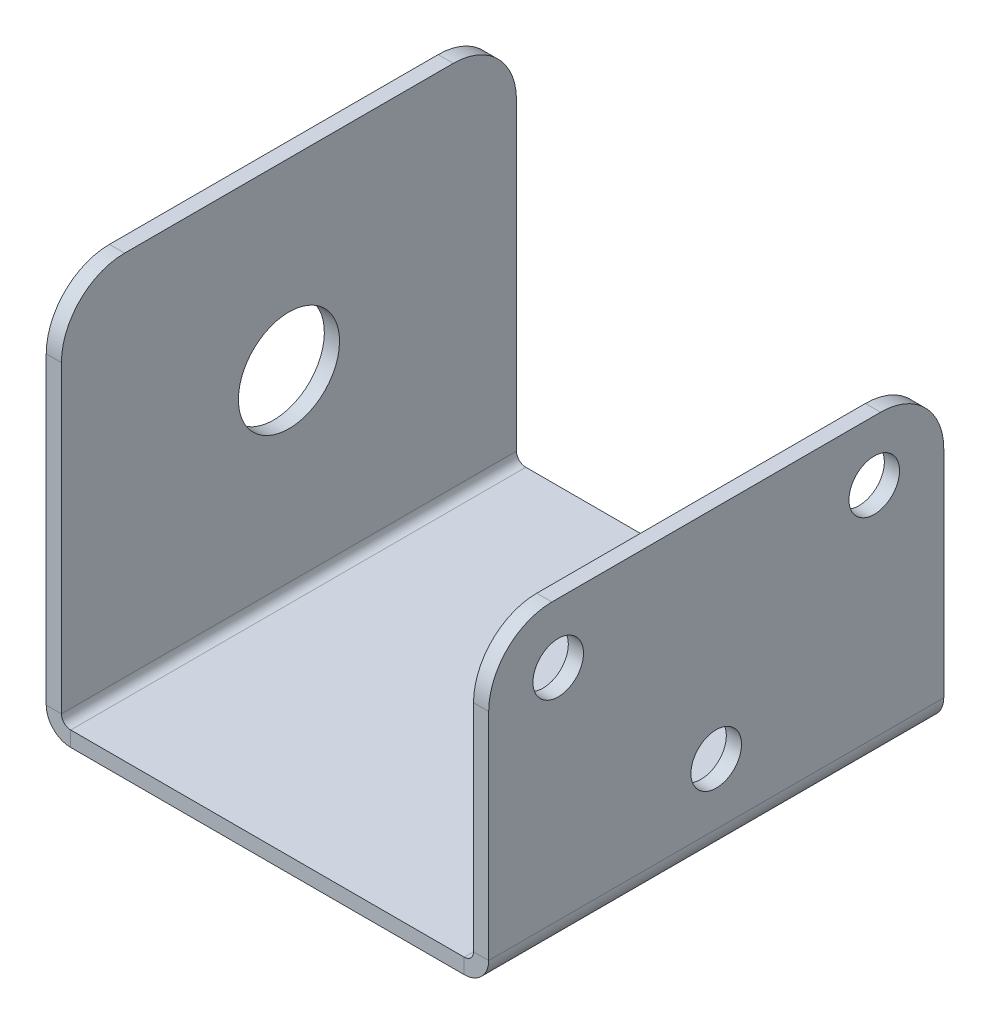
from build123d import *

# Parameters (mm, degrees)
CROQUIS1_W                         = 35
CROQUIS1_H                         = 36
BRIDA_BASE1_DEPTH                  = 1.2
BRIDA_DE_ARISTA1_STRIP_W           = 6.2732
BRIDA_DE_ARISTA1_STRIP_H           = 1.2
BRIDA_DE_ARISTA1_STRIP_CUT_DEPTH   = 36
BRIDA_DE_ARISTA1_STRIP_2_W         = 6.2732
BRIDA_DE_ARISTA1_STRIP_2_H         = 1.2
BRIDA_DE_ARISTA1_STRIP_CUT_2_DEPTH = 36
BRIDA_DE_ARISTA1_DEPTH             = 36
BRIDA_DE_ARISTA1_BEND_DEPTH        = 36
CROQUIS14_W                        = 36
CROQUIS14_H                        = 7
CORTAR_EXTRUIR3_DEPTH              = 1.2
CROQUIS12_R                        = 2
CORTAR_EXTRUIR1_DEPTH              = 1.2
CROQUIS13_R                        = 4
CORTAR_EXTRUIR2_DEPTH              = 1.2
REDONDEO1_R                        = 5


# Sheet-metal steps are written as plain solids
with BuildPart() as part:
    # Croquis1 → Brida base1 (new body)
    with BuildSketch(Plane(origin=(0, 0, 0), x_dir=(1, 0, 0), z_dir=(0, 1, 0))):
        Rectangle(CROQUIS1_W, CROQUIS1_H)
    extrude(amount=-BRIDA_BASE1_DEPTH)

    # Brida de arista1 strip (across the edge) → Brida de arista1 strip cut (cut)
    with BuildSketch(Plane(origin=(17.5, 0, 18), x_dir=(-1, 0, 0), z_dir=(0, 0, -1))):
        with Locations((-1.2, -0.6)):
            Rectangle(BRIDA_DE_ARISTA1_STRIP_W, BRIDA_DE_ARISTA1_STRIP_H)
    extrude(amount=BRIDA_DE_ARISTA1_STRIP_CUT_DEPTH, mode=Mode.SUBTRACT)

    # Brida de arista1 strip 2 (across the edge) → Brida de arista1 strip cut 2 (cut)
    with BuildSketch(Plane(origin=(-17.5, 0, -18), x_dir=(1, 0, 0), z_dir=(0, 0, 1))):
        with Locations((-1.2, -0.6)):
            Rectangle(BRIDA_DE_ARISTA1_STRIP_2_W, BRIDA_DE_ARISTA1_STRIP_2_H)
    extrude(amount=BRIDA_DE_ARISTA1_STRIP_CUT_2_DEPTH, mode=Mode.SUBTRACT)

    # Brida de arista1 section (across the edge) → Brida de arista1 (add)
    with BuildSketch(Plane(origin=(17.5, 0, 18), x_dir=(-1, 0, 0), z_dir=(0, 0, -1))):
        with BuildLine():
            Line((0, 0.7366), (0, 29.8))
            Line((0, 29.8), (1.2, 29.8))
            Line((1.2, 29.8), (1.2, 0.7366))
            ThreePointArc((1.2, 0.7366), (1.415745145, 0.215745145), (1.9366, 0))
            Line((1.9366, 0), (1.9366, -1.2))
            ThreePointArc((1.9366, -1.2), (0.567217008, -0.632782992), (0, 0.7366))
        make_face()
    extrude(amount=BRIDA_DE_ARISTA1_DEPTH)

    # Brida de arista1 section 2 (across the edge) → Brida de arista1 bend (add)
    with BuildSketch(Plane(origin=(-17.5, 0, -18), x_dir=(1, 0, 0), z_dir=(0, 0, 1))):
        with BuildLine():
            Line((0, 0.7366), (0, 29.8))
            Line((0, 29.8), (1.2, 29.8))
            Line((1.2, 29.8), (1.2, 0.7366))
            ThreePointArc((1.2, 0.7366), (1.415745145, 0.215745145), (1.9366, 0))
            Line((1.9366, 0), (1.9366, -1.2))
            ThreePointArc((1.9366, -1.2), (0.567217008, -0.632782992), (0, 0.7366))
        make_face()
    extrude(amount=BRIDA_DE_ARISTA1_BEND_DEPTH)

    # Croquis14 → Cortar-Extruir3 (cut)
    with BuildSketch(Plane(origin=(17.5, 0, 0), x_dir=(0, 0, -1), z_dir=(1, 0, 0))):
        with Locations((0, 26.3)):
            Rectangle(CROQUIS14_W, CROQUIS14_H)
    extrude(amount=-CORTAR_EXTRUIR3_DEPTH, mode=Mode.SUBTRACT)

    # Croquis12 → Cortar-Extruir1 (cut)
    with BuildSketch(Plane(origin=(17.5, 0, 0), x_dir=(0, 0, -1), z_dir=(1, 0, 0))):
        with Locations(Location((-12.5, 18.05, 0), (0, 0, 90))):
            Circle(CROQUIS12_R)
        with Locations(Location((12.5, 18.05, 0), (0, 0, 90))):
            Circle(CROQUIS12_R)
        with Locations(Location((0, 5.55, 0), (0, 0, 90))):
            Circle(CROQUIS12_R)
    extrude(amount=-CORTAR_EXTRUIR1_DEPTH, mode=Mode.SUBTRACT)

    # Croquis13 → Cortar-Extruir2 (cut)
    with BuildSketch(Plane(origin=(-16.3, 0, 0), x_dir=(0, 0, -1), z_dir=(1, 0, 0))):
        with Locations(Location((0, 15.2683, 0), (0, 0, 90))):
            Circle(CROQUIS13_R)
    extrude(amount=-CORTAR_EXTRUIR2_DEPTH, mode=Mode.SUBTRACT)

    # Redondeo1
    redondeo1_edges = [part.edges().sort_by_distance(p)[0] for p in [
        (-16.9, 29.8, -18),
        (-16.9, 29.8, 18),
        (16.9, 22.8, 18),
        (16.9, 22.8, -18),
    ]]
    fillet(redondeo1_edges, radius=REDONDEO1_R)


solid = part.part
